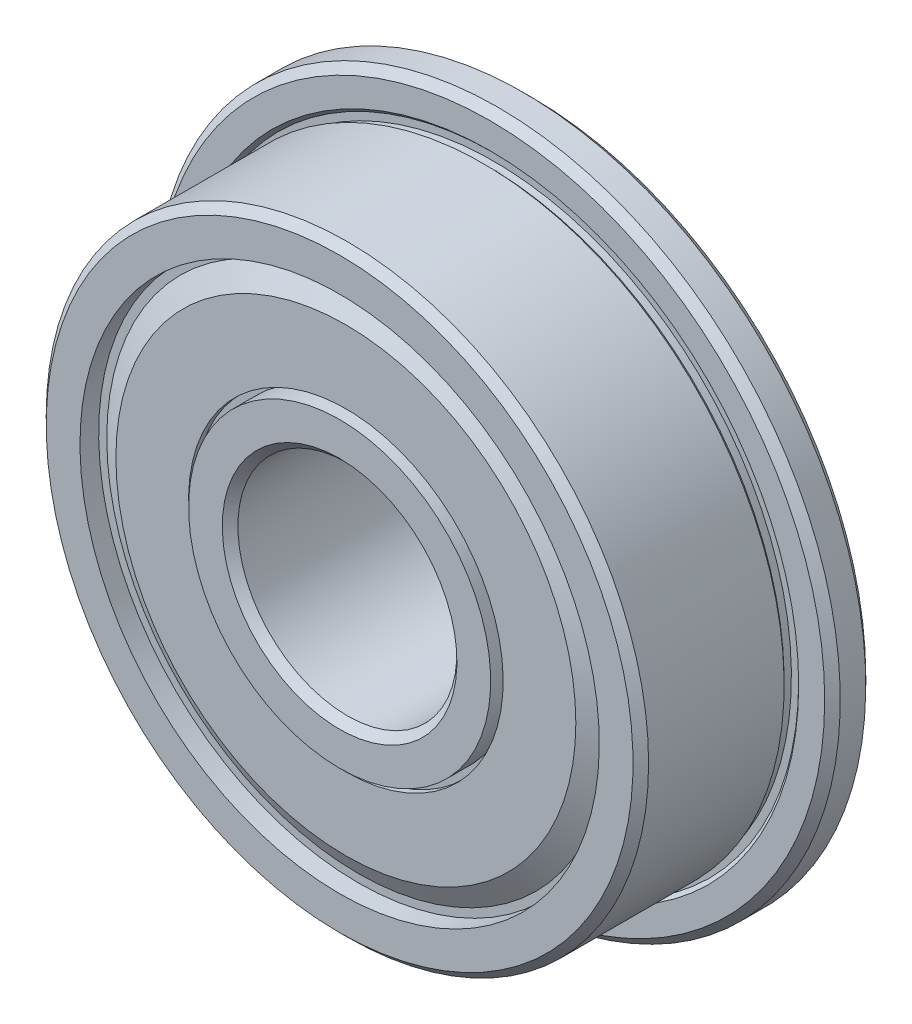
from build123d import *

# Parameters (mm, degrees)
FILLET1_SIZE      = 0.284375
FILLET2_SIZE      = 0.284375
CIRPATTERN3_COUNT = 8
SKETCH8_W         = 0.91
SKETCH8_H         = 0.758333333


with BuildPart() as part:
    # Sketch2 → Revolve1 (revolve)
    with BuildSketch(Plane(origin=(0, 0, 0), x_dir=(0, 0, -1), z_dir=(1, 0, 0))):
        with BuildLine():
            Line((3.5, 12.5), (2, 12.5))
            Line((2, 12.5), (2, 11.265165043))
            Line((2, 11.265165043), (2.132582521, 11.132582521))
            Line((2.132582521, 11.132582521), (2.132582521, 10.867417479))
            Line((2.132582521, 10.867417479), (1.867417479, 10.867417479))
            Line((1.867417479, 10.867417479), (1.734834957, 11))
            Line((1.734834957, 11), (-3.5, 11))
            Line((-3.5, 11), (-3.5, 8.725))
            Line((-3.5, 8.725), (-1.561286409, 8.725))
            ThreePointArc((-1.561286409, 8.725), (0, 9.4845), (1.561286409, 8.725))
            Line((1.561286409, 8.725), (3.5, 8.725))
            Line((3.5, 8.725), (3.5, 12.5))
        make_face()
        with BuildLine():
            Line((3.5, 4), (-3.5, 4))
            Line((-3.5, 4), (-3.5, 6.275))
            Line((-3.5, 6.275), (-1.561286409, 6.275))
            ThreePointArc((-1.561286409, 6.275), (0, 5.5155), (1.561286409, 6.275))
            Line((1.561286409, 6.275), (3.5, 6.275))
            Line((3.5, 6.275), (3.5, 4))
        make_face()
    revolve(axis=Axis((0, 0, 0), (0, 0, -1)))

    # Fillet1
    fillet1_edges = [part.edges().sort_by_distance(p)[0] for p in [
        (0, -12.5, -3.5),
        (0, -12.5, -2),
        (0, -11, 3.5),
    ]]
    chamfer(fillet1_edges, length=FILLET1_SIZE)

    # Fillet2
    fillet2_edges = [part.edges().sort_by_distance(p)[0] for p in [
        (0, -4, -3.5),
        (0, -4, 3.5),
    ]]
    chamfer(fillet2_edges, length=FILLET2_SIZE)

    # Sketch8 → Cut-Revolve1 (revolve, cut)
    with BuildSketch(Plane(origin=(0, 0, 0), x_dir=(0, 0, -1), z_dir=(1, 0, 0))):
        with Locations((-3.045, 9.104166667)):
            Rectangle(SKETCH8_W, SKETCH8_H)
        with Locations((3.045, 9.104166667)):
            Rectangle(SKETCH8_W, SKETCH8_H)
        with Locations((3.045, 5.895833334)):
            Rectangle(SKETCH8_W, SKETCH8_H)
        with Locations((-3.045, 5.895833334)):
            Rectangle(SKETCH8_W, SKETCH8_H)
    revolve(axis=Axis((0, 0, 0), (0, 0, -1)), mode=Mode.SUBTRACT)


with BuildPart() as body_2:
    # Sketch7 → Revolve3 (revolve)
    with BuildSketch(Plane.XY):
        with BuildLine():
            Line((0, 9.4845), (0, 5.5155))
            ThreePointArc((0, 5.5155), (-1.9845, 7.5), (0, 9.4845))
        make_face()
    revolve(axis=Axis((0, 9.4845, 0), (0, -1, 0)))


with BuildPart() as cirpattern3_1:
    # CirPattern3: pattern copy
    add(body_2.part.rotate(Axis((0, 0, 0), (0, 0, -1)), 1 * 360 / CIRPATTERN3_COUNT))


with BuildPart() as cirpattern3_2:
    # CirPattern3: pattern copy
    add(body_2.part.rotate(Axis((0, 0, 0), (0, 0, -1)), 2 * 360 / CIRPATTERN3_COUNT))


with BuildPart() as cirpattern3_3:
    # CirPattern3: pattern copy
    add(body_2.part.rotate(Axis((0, 0, 0), (0, 0, -1)), 3 * 360 / CIRPATTERN3_COUNT))


with BuildPart() as cirpattern3_4:
    # CirPattern3: pattern copy
    add(body_2.part.rotate(Axis((0, 0, 0), (0, 0, -1)), 4 * 360 / CIRPATTERN3_COUNT))


with BuildPart() as cirpattern3_5:
    # CirPattern3: pattern copy
    add(body_2.part.rotate(Axis((0, 0, 0), (0, 0, -1)), 5 * 360 / CIRPATTERN3_COUNT))


with BuildPart() as cirpattern3_6:
    # CirPattern3: pattern copy
    add(body_2.part.rotate(Axis((0, 0, 0), (0, 0, -1)), 6 * 360 / CIRPATTERN3_COUNT))


with BuildPart() as cirpattern3_7:
    # CirPattern3: pattern copy
    add(body_2.part.rotate(Axis((0, 0, 0), (0, 0, -1)), 7 * 360 / CIRPATTERN3_COUNT))


with BuildPart() as body_10:
    # Sketch9 → Revolve4 (revolve)
    with BuildSketch(Plane(origin=(0, 0, 0), x_dir=(0, 0, -1), z_dir=(1, 0, 0))):
        Polygon((-2.59, 9.483333333), (-2.59, 9.126190476), (-3.045, 8.338107359), (-3.045, 5.744166667), (-3.2725, 5.744166667), (-3.2725, 8.3990658), (-2.8175, 9.187148917), (-2.8175, 9.483333333), align=None)
        Polygon((2.59, 9.483333333), (2.59, 9.126190476), (3.045, 8.338107359), (3.045, 5.744166667), (3.2725, 5.744166667), (3.2725, 8.3990658), (2.8175, 9.187148917), (2.8175, 9.483333333), align=None)
    revolve(axis=Axis((0, 0, 0), (0, 0, -1)))


solid = Compound([part.part, body_2.part, cirpattern3_1.part, cirpattern3_2.part, cirpattern3_3.part, cirpattern3_4.part, cirpattern3_5.part, cirpattern3_6.part, cirpattern3_7.part, body_10.part])
